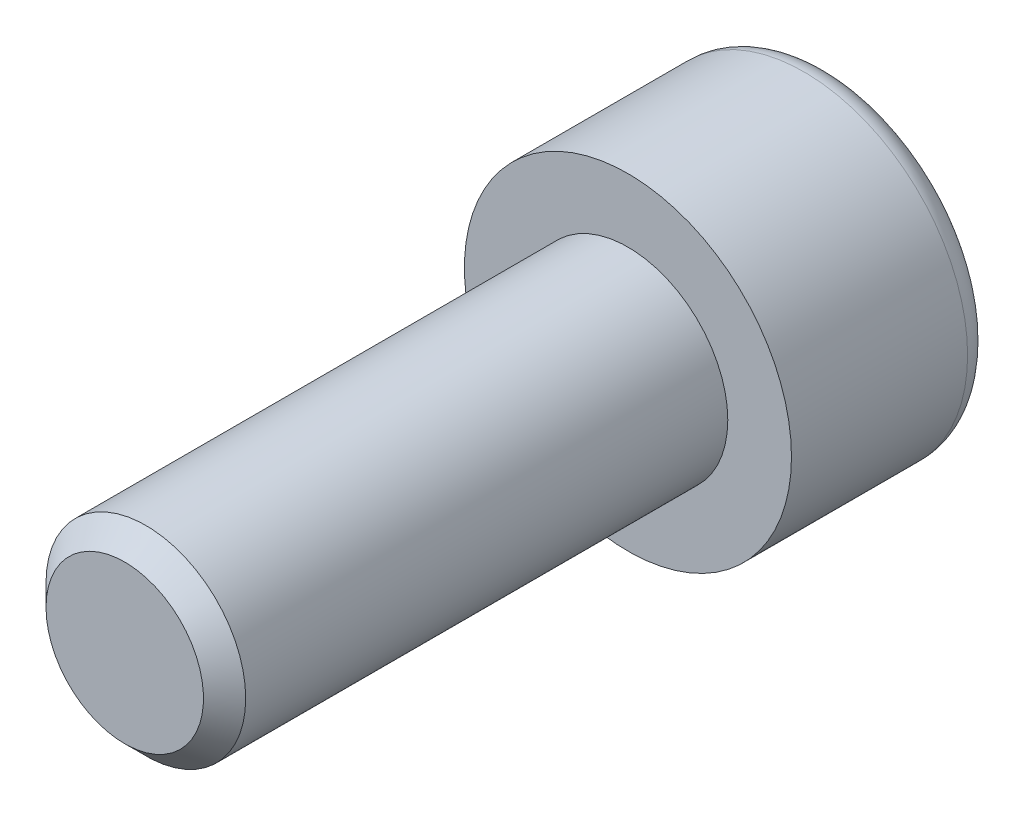
from build123d import *

# Parameters (mm, degrees)
SKETCH_1_R               = 6.5
EXTRUDE_1_DEPTH          = 8
SKETCH_2_R               = 4
EXTRUDE_2_DEPTH          = 20
FILLET_1_R               = 1
CUT_EXTRUDE_1_DEPTH      = 30.470324079
CUT_EXTRUDE_1_DEPTH_BACK = 2


# Read off the part's stored shape, not the designer's step: 5/16-18 机械螺纹 螺柱1
with BuildPart() as part:
    # 草图1 → 凸台-拉伸1 (new body)
    with BuildSketch(Plane.XY):
        Circle(SKETCH_1_R)
    extrude(amount=EXTRUDE_1_DEPTH)

    # 草图2 → 凸台-拉伸2 (add)
    with BuildSketch(Plane.XY.offset(8)):
        Circle(SKETCH_2_R)
    extrude(amount=EXTRUDE_2_DEPTH)

    # 5/16-18 机械螺纹 螺柱1 outline → 5/16-18 机械螺纹 螺柱1 (revolve, cut)
    with BuildSketch(Plane.XZ):
        Polygon((4, 28), (3.12928, 28), (3.96875, 27.16053), (3.96875, 8), (4, 8), align=None)
    revolve(axis=Axis((0, 0, 0), (0, 0, 1)), mode=Mode.SUBTRACT)

    # 圆角1
    fillet_1_edges = [part.edges().sort_by_distance(p)[0] for p in [
        (-6.5, 0, 0),
    ]]
    fillet(fillet_1_edges, radius=FILLET_1_R)

    # 草图4 → 切除-拉伸1 (cut, two sides: drawn at the far end of the back side and taken through both)
    with BuildSketch(Plane(origin=(0, 0, 0), x_dir=(-1, 0, 0), z_dir=(0, 0, -1)).offset(-CUT_EXTRUDE_1_DEPTH_BACK)):
        Polygon((3.5, 0), (1.75, 3.031088913), (-1.75, 3.031088913), (-3.5, 0), (-1.75, -3.031088913), (1.75, -3.031088913), align=None)
    extrude(amount=CUT_EXTRUDE_1_DEPTH + CUT_EXTRUDE_1_DEPTH_BACK, mode=Mode.SUBTRACT)


solid = part.part
